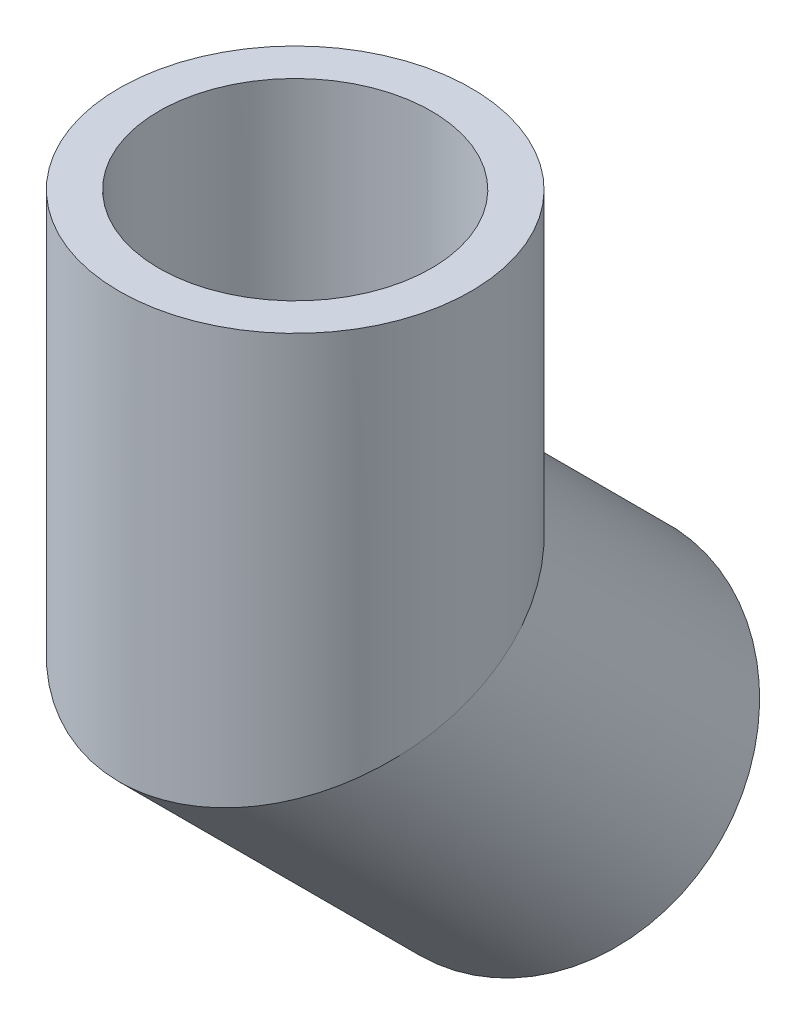
from build123d import *

# Parameters (mm, degrees)
SKETCH2_R   = 12.7
SKETCH2_R_2 = 9.8298


with BuildPart() as part:
    # Sweep1: sweep along a path in Sketch3
    with BuildLine(Plane(origin=(0, 0, 0), x_dir=(0, 0, -1), z_dir=(1, 0, 0))) as sweep1_path:
        Line((0, 0), (0, -25.4))
        Line((0, -25.4), (17.960512242, -43.360512242))
    # Sketch2 → Sweep1 (sweep)
    with BuildSketch(Plane(origin=(0, 0, 0), x_dir=(1, 0, 0), z_dir=(0, 1, 0))):
        Circle(SKETCH2_R)
        Circle(SKETCH2_R_2, mode=Mode.SUBTRACT)
    sweep(path=sweep1_path.line, transition=Transition.RIGHT)


solid = part.part
